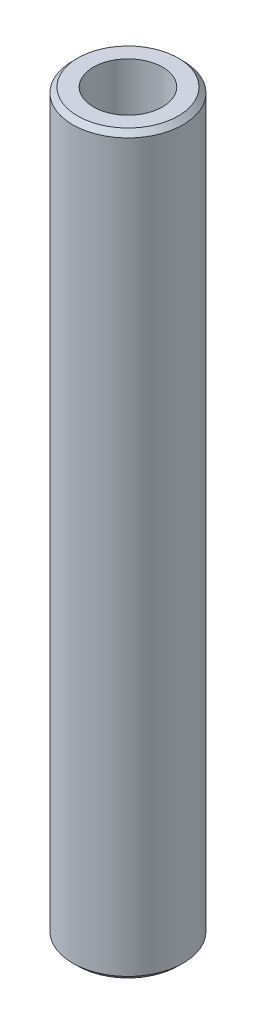
from build123d import *
from OCP.BRepFilletAPI import BRepFilletAPI_MakeChamfer

# Parameters (mm, degrees)
SKETCH1_R           = 45
BOSS_EXTRUDE1_DEPTH = 600
SKETCH2_R           = 28.148813309
CUT_EXTRUDE1_DEPTH  = 604.365560834
CHAMFER1_SIZE       = 4.136273919
CHAMFER1_SIZE2      = 4.049842211


with BuildPart() as part:
    # Sketch1 → Boss-Extrude1 (new body)
    with BuildSketch(Plane(origin=(0, 0, 0), x_dir=(1, 0, 0), z_dir=(0, 1, 0))):
        Circle(SKETCH1_R)
    extrude(amount=BOSS_EXTRUDE1_DEPTH)

    # Sketch2 → Cut-Extrude1 (cut, through all)
    with BuildSketch(Plane(origin=(0, 0, 0), x_dir=(1, 0, 0), z_dir=(0, 1, 0))):
        Circle(SKETCH2_R)
    extrude(amount=CUT_EXTRUDE1_DEPTH, mode=Mode.SUBTRACT)

    # Chamfer1: one chamfer whose edges measure the first distance from different faces: ONE call of the kernel's chamfer builder (chamfer() names one face for all edges)
    chamfer1_edges_1 = [part.edges().sort_by_distance(p)[0] for p in [
        (-45, 600, 0),
    ]]
    chamfer1_side_1 = [part.faces().sort_by_distance(p)[0] for p in [
        (-45, 300, 0),
    ]]
    chamfer1_edges_2 = [part.edges().sort_by_distance(p)[0] for p in [
        (-45, 0, 0),
    ]]
    chamfer1_side_2 = [part.faces().sort_by_distance(p)[0] for p in [
        (-43.727207794, 0, 0),
    ]]
    chamfer1 = BRepFilletAPI_MakeChamfer(part.part.solid().wrapped)
    for e in chamfer1_edges_1:
        chamfer1.Add(CHAMFER1_SIZE, CHAMFER1_SIZE2, e.wrapped, chamfer1_side_1[0].wrapped)  # the first distance lies on this face
    for e in chamfer1_edges_2:
        chamfer1.Add(CHAMFER1_SIZE, CHAMFER1_SIZE2, e.wrapped, chamfer1_side_2[0].wrapped)  # the first distance lies on this face
    add(Compound.cast(chamfer1.Shape()), mode=Mode.REPLACE)


solid = part.part
